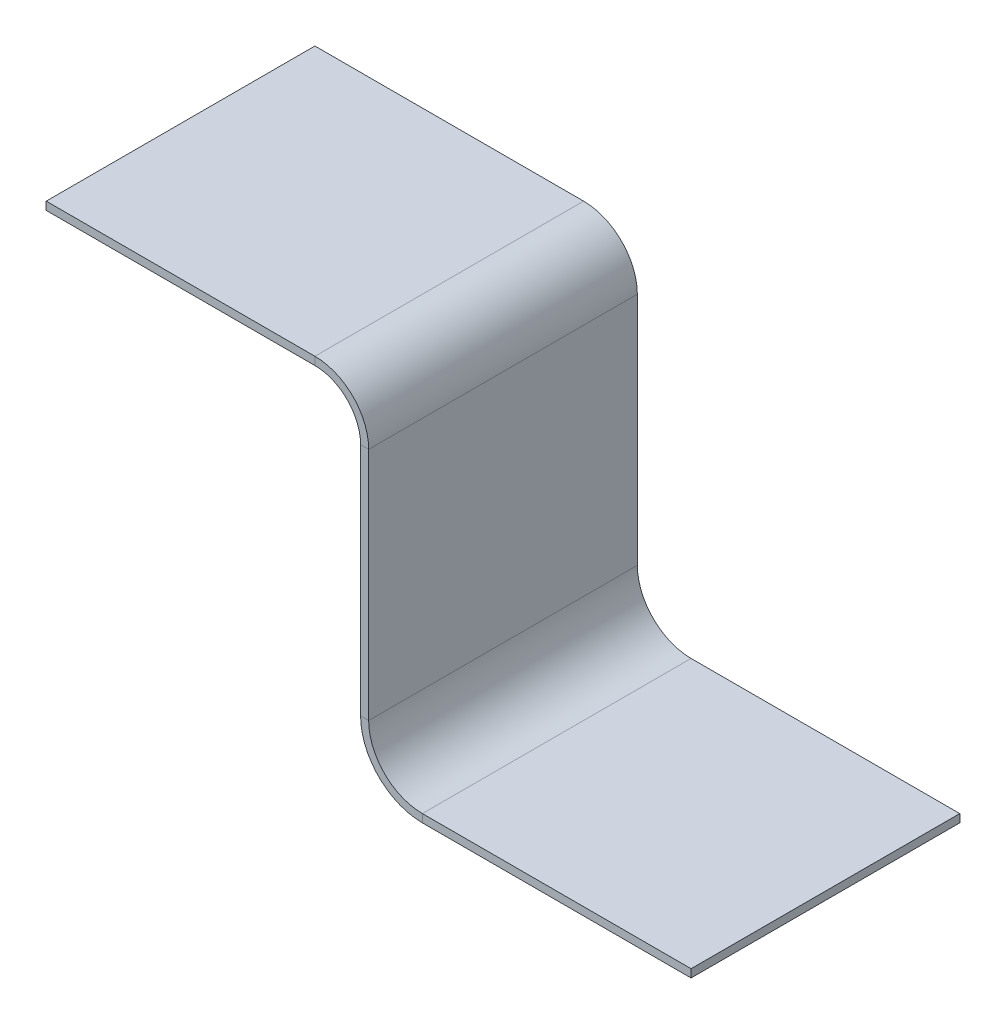
from build123d import *

# Parameters (mm, degrees)
BASE_FLANGE1_DEPTH = 5


# Sheet-metal steps are written as plain solids
with BuildPart() as part:
    # Sketch2 → Base-Flange1 (new body)
    with BuildSketch(Plane.XY):
        with BuildLine():
            Line((-6, 6.37), (-1, 6.37))
            ThreePointArc((-1, 6.37), (-0.292893219, 6.077106781), (0, 5.37))
            Line((0, 5.37), (0, 1))
            ThreePointArc((0, 1), (0.292893219, 0.292893219), (1, 0))
            Line((1, 0), (6, 0))
            Line((6, 0), (6, -0.15))
            Line((6, -0.15), (1, -0.15))
            ThreePointArc((1, -0.15), (0.186827202, 0.186827202), (-0.15, 1))
            Line((-0.15, 1), (-0.15, 5.37))
            ThreePointArc((-0.15, 5.37), (-0.398959236, 5.971040764), (-1, 6.22))
            Line((-1, 6.22), (-6, 6.22))
            Line((-6, 6.22), (-6, 6.37))
        make_face()
    extrude(amount=BASE_FLANGE1_DEPTH)


solid = part.part
